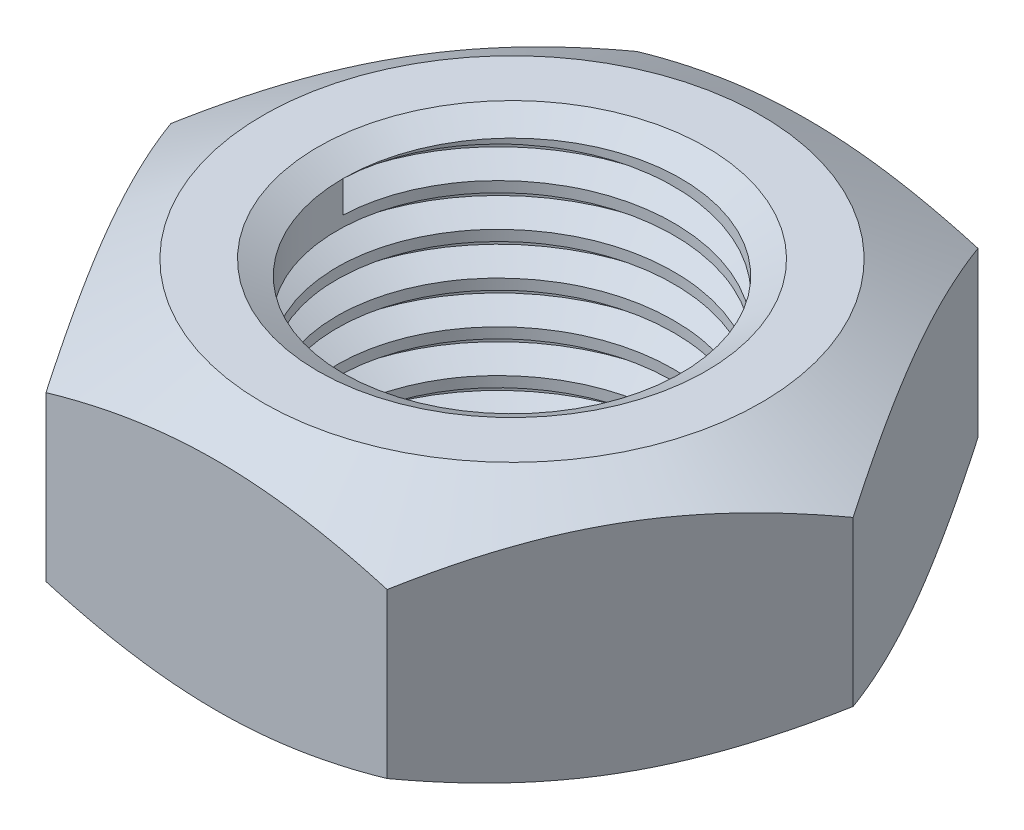
from build123d import *

# Parameters (mm, degrees)
SALIENTE_EXTRUIR1_DEPTH = 3.2
CROQUIS4_R              = 2
CORTAR_EXTRUIR1_DEPTH   = 7.23083729
ROSCAM3_PITCH           = 0.5


with BuildPart() as part:
    # Croquis1 → Saliente-Extruir1 (new body)
    with BuildSketch(Plane(origin=(0, 0, 0), x_dir=(1, 0, 0), z_dir=(0, 1, 0))):
        Polygon((4.041451884, 0), (2.020725942, 3.5), (-2.020725942, 3.5), (-4.041451884, 0), (-2.020725942, -3.5), (2.020725942, -3.5), align=None)
    extrude(amount=SALIENTE_EXTRUIR1_DEPTH)

    # Croquis3 → Cortar-Revolución1 (revolve, cut)
    with BuildSketch(Plane.XY, mode=Mode.PRIVATE) as cortar_revoluci_n1_sk:
        with BuildLine():
            Line((2.95, 3.2), (4.041451884, 2.569849961))
            add(Edge.make_bspline(
                [(2.95, 3.2), (2.595887545, 12.013865927), (18.879981399, 3.5441679), (4.041451884, 2.569849961)],
                knots=[0, 0, 0, 0, 1, 1, 1, 1], degree=3))
        make_face()
    cortar_revoluci_n1 = revolve(cortar_revoluci_n1_sk.sketch.rotate(Axis((0, 2.52, 0), (0, -1, 0)), 300.000000005), axis=Axis((0, 2.52, 0), (0, -1, 0)), mode=Mode.SUBTRACT)

    # Croquis4 → Cortar-Extruir1 (cut, through all)
    with BuildSketch(Plane(origin=(0, 3.2, 0), x_dir=(1, 0, 0), z_dir=(0, 1, 0))):
        with Locations(Location((0, 0, 0), (0, 0, 270))):
            Circle(CROQUIS4_R)
    extrude(amount=-CORTAR_EXTRUIR1_DEPTH, mode=Mode.SUBTRACT)

    # Croquis5 → Cortar-Revolución2 (revolve, cut)
    with BuildSketch(Plane.XY, mode=Mode.PRIVATE) as cortar_revoluci_n2_sk:
        with BuildLine():
            Line((0.944462256, 2.417379919), (2.3, 3.2))
            add(Edge.make_bspline(
                [(2.3, 3.2), (6.27046431, 12.388151499), (-1.28099524, 4.318614815), (0.944462256, 2.417379919)],
                knots=[0, 0, 0, 0, 1, 1, 1, 1], degree=3))
        make_face()
    cortar_revoluci_n2 = revolve(cortar_revoluci_n2_sk.sketch.rotate(Axis((0, 2.52, 0), (0, -1, 0)), 90), axis=Axis((0, 2.52, 0), (0, -1, 0)), mode=Mode.SUBTRACT)

    # Simetría1: Cortar-Revolución1, Cortar-Revolución2 across plane
    add(cortar_revoluci_n1.mirror(Plane(origin=(0, 1.6, 0), x_dir=(0, 0, 1), z_dir=(0, -1, 0))), mode=Mode.SUBTRACT)
    add(cortar_revoluci_n2.mirror(Plane(origin=(0, 1.6, 0), x_dir=(0, 0, 1), z_dir=(0, -1, 0))), mode=Mode.SUBTRACT)

    # RoscaM3: the profile of Perfil de rosca1 profile screwed along a right-hand helix of 6.05359 turns, 6 arcs to a turn; built about Z, then put on its axis
    roscam3_z = Axis((0, 0, 0), (0, 0, 1))
    roscam3_corners = [(1.9997, 0, -0.000173205), (2.270632937, 0, 0.156249999), (2.270632937, 0, 0.218749999), (1.9997, 0, 0.375173203)]
    with BuildLine(mode=Mode.PRIVATE) as roscam3_profile:
        Line(roscam3_corners[0], roscam3_corners[1])
        Line(roscam3_corners[1], roscam3_corners[2])
        Line(roscam3_corners[2], roscam3_corners[3])
        Line(roscam3_corners[3], roscam3_corners[0])
    roscam3_cap = Face(roscam3_profile.wire())
    roscam3_turn_angles = [0, 30, 60, 90, 120, 150, 180, 210, 240, 270, 300, 330, 360]
    roscam3_turn_weights = [1, 0.8660254037844387, 1, 0.8660254037844387, 1, 0.8660254037844387, 1, 0.8660254037844387, 1, 0.8660254037844387, 1, 0.8660254037844387, 1]
    roscam3_turn_rails = [Edge.make_bspline([Vector(p[0], p[1], 0).rotate(roscam3_z, roscam3_turn_angles[k]) / roscam3_turn_weights[k] + Vector(0, 0, p[2] + ROSCAM3_PITCH * roscam3_turn_angles[k] / 360) for k in range(13)], [0, 0, 0, 1, 1, 2, 2, 3, 3, 4, 4, 5, 5, 6, 6, 6], 2, roscam3_turn_weights) for p in roscam3_corners]
    roscam3_turn_sides = [Face.make_surface_from_curves(roscam3_turn_rails[p[0]], roscam3_turn_rails[p[1]]) for p in [(0, 1), (1, 2), (2, 3), (3, 0)]]
    roscam3_last_angles = [2160, 2169.646170928, 2179.292341855]
    roscam3_last_weights = [1, 0.9858613289035193, 1]
    roscam3_last_rails = [Edge.make_bspline([Vector(p[0], p[1], 0).rotate(roscam3_z, roscam3_last_angles[k]) / roscam3_last_weights[k] + Vector(0, 0, p[2] + ROSCAM3_PITCH * roscam3_last_angles[k] / 360) for k in range(3)], [0, 0, 0, 1, 1, 1], 2, roscam3_last_weights) for p in roscam3_corners]
    roscam3_last_sides = [Face.make_surface_from_curves(roscam3_last_rails[p[0]], roscam3_last_rails[p[1]]) for p in [(0, 1), (1, 2), (2, 3), (3, 0)]]
    roscam3 = Plane(origin=(0, 3.026794919, 0), x_dir=(-1, 0, 0), z_dir=(0, -1, 0)) * Solid(Shell([*[p.moved(Location((0, 0, ROSCAM3_PITCH * i))) for i in range(6) for p in roscam3_turn_sides], *roscam3_last_sides, roscam3_cap, roscam3_cap.rotate(roscam3_z, 2179.292341855).moved(Location((0, 0, ROSCAM3_PITCH * 2179.292341855 / 360)))]))
    add(roscam3, mode=Mode.SUBTRACT)


solid = part.part
